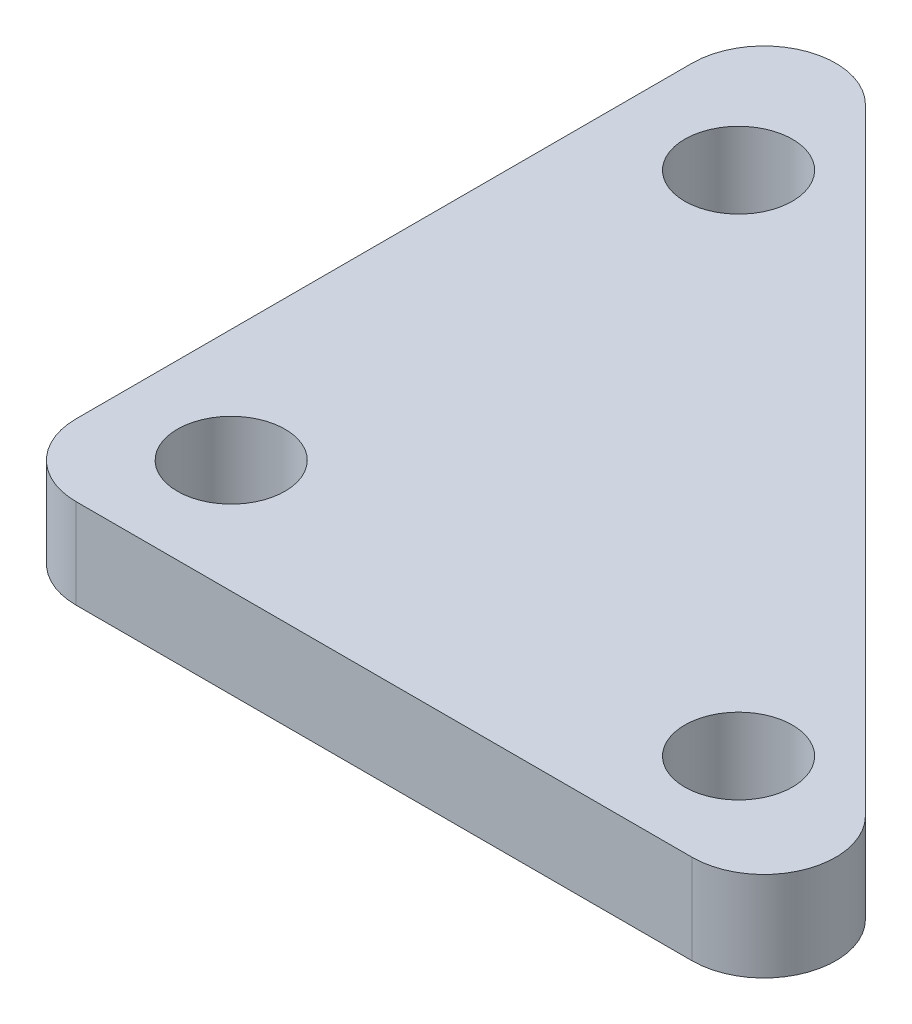
from build123d import *

# Parameters (mm, degrees)
BOSS_EXTRUDE1_DEPTH = 2.5
FILLET1_R           = 2
SKETCH2_R           = 1.5
CUT_EXTRUDE1_DEPTH  = 28.07866619


with BuildPart() as part:
    # Sketch1 → Boss-Extrude1 (new body)
    with BuildSketch(Plane(origin=(0, 0, 0), x_dir=(1, 0, 0), z_dir=(0, 1, 0))):
        Polygon((-0.813390539, -17.679043374), (23.186609461, -17.679043374), (-0.813390539, 6.320956626), align=None)
    extrude(amount=BOSS_EXTRUDE1_DEPTH)

    # Fillet1
    fillet1_edges = [part.edges().sort_by_distance(p)[0] for p in [
        (-0.813390539, 1.25, 17.679043374),
        (-0.813390539, 1.25, -6.320956626),
        (23.186609461, 1.25, 17.679043374),
    ]]
    fillet(fillet1_edges, radius=FILLET1_R)

    # Sketch2 → Cut-Extrude1 (cut, through all)
    with BuildSketch(Plane(origin=(0, 2.5, 0), x_dir=(1, 0, 0), z_dir=(0, 1, 0))):
        with Locations((2.347774696, -14.517878139)):
            Circle(SKETCH2_R)
        with Locations((2.41824209, -0.446209909)):
            Circle(SKETCH2_R)
        with Locations((16.560377713, -14.588345533)):
            Circle(SKETCH2_R)
    extrude(amount=-CUT_EXTRUDE1_DEPTH, mode=Mode.SUBTRACT)


solid = part.part
